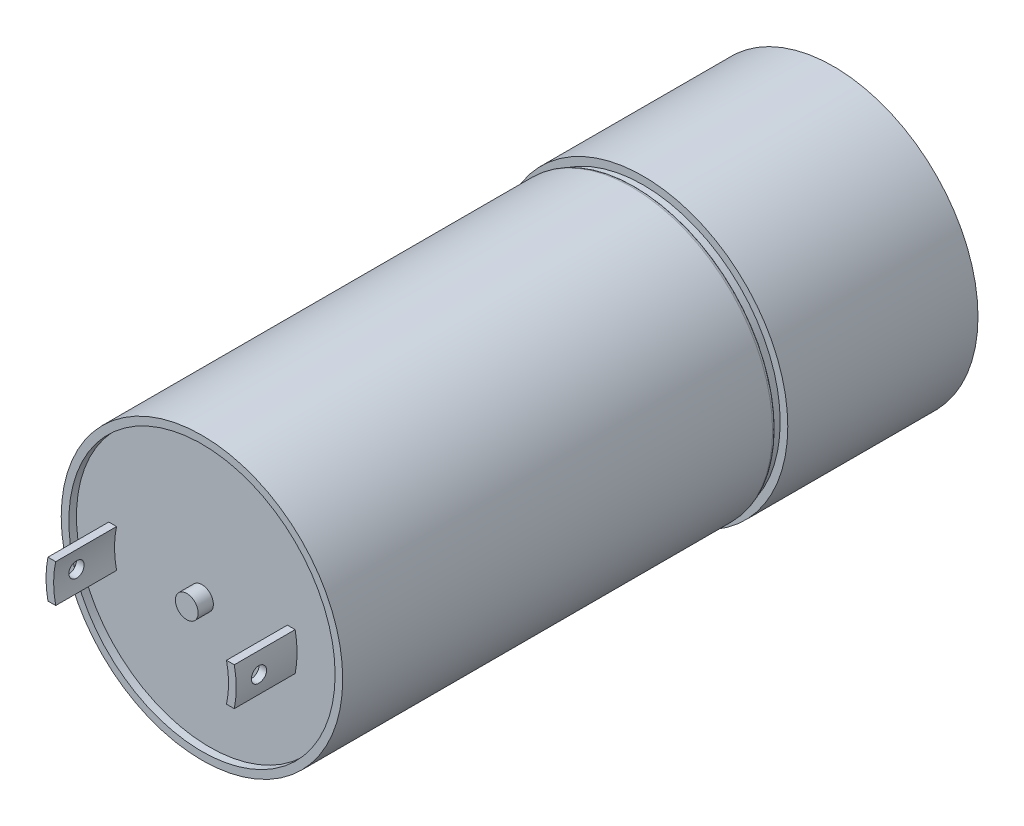
from build123d import *

# Parameters (mm, degrees)
SKETCH_1_R                      = 18.5
EXTRUDE_1_DEPTH                 = 83
SKETCH_2_R                      = 1.5
EXTRUDE_2_DEPTH                 = 2
EXTRUDE_3_DEPTH                 = 8
CUT_EXTRUDE_2_REACH             = 96.686
SKETCH_6_R                      = 1
CUT_EXTRUDE_2_DIRECTION_2_REACH = 96.686
SKETCH_7_R                      = 1.5
CUT_EXTRUDE_3_DEPTH             = 10
SKETCH_8_R                      = 6
EXTRUDE_4_DEPTH                 = 5
SKETCH_10_R                     = 3
CUT_EXTRUDE_4_DEPTH             = 20
SKETCH_11_R                     = 18.5
SKETCH_11_R_2                   = 18
CUT_EXTRUDE_5_DEPTH             = 1
EXTRUDE_START                   = 25
SKETCH_12_R                     = 19
SKETCH_12_R_2                   = 18.5
EXTRUDE_5_DEPTH                 = 25
FILLET_1_R                      = 0.5
SKETCH_13_R                     = 17.5
CUT_EXTRUDE_6_DEPTH             = 1


with BuildPart() as part:
    # 草图1 → 凸台-拉伸1 (new body)
    with BuildSketch(Plane.XY):
        Circle(SKETCH_1_R)
    extrude(amount=EXTRUDE_1_DEPTH)

    # 草图2 → 凸台-拉伸2 (add)
    with BuildSketch(Plane.XY.offset(83)):
        Circle(SKETCH_2_R)
    extrude(amount=EXTRUDE_2_DEPTH)

    # 草图4 → 凸台-拉伸3 (add)
    with BuildSketch(Plane.XY.offset(83)):
        with BuildLine():
            Line((-12.247448714, 2.5), (-11.22497216, 2.5))
            ThreePointArc((-11.22497216, 2.5), (-11.5, 0), (-11.22497216, -2.5))
            Line((-11.22497216, -2.5), (-12.247448714, -2.5))
            ThreePointArc((-12.247448714, -2.5), (-12.5, 0), (-12.247448714, 2.5))
        make_face()
        with BuildLine():
            Line((11.22497216, 2.5), (12.247448714, 2.5))
            ThreePointArc((12.247448714, 2.5), (12.5, 0), (12.247448714, -2.5))
            Line((12.247448714, -2.5), (11.22497216, -2.5))
            ThreePointArc((11.22497216, -2.5), (11.5, 0), (11.22497216, 2.5))
        make_face()
    extrude(amount=EXTRUDE_3_DEPTH)

    # 草图6 → 切除-拉伸2 (cut, up to next)
    with BuildSketch(Plane(origin=(0, 0, 0), x_dir=(0, 0, -1), z_dir=(1, 0, 0)), mode=Mode.PRIVATE) as cut_extrude_2_sk1:
        with Locations(Location((-88, 0, 0), (0, 0, 180))):
            Circle(SKETCH_6_R)
    cut_extrude_2_tool1 = extrude(cut_extrude_2_sk1.sketch, amount=-CUT_EXTRUDE_2_REACH, mode=Mode.PRIVATE) & part.part
    add(cut_extrude_2_tool1.solids().sort_by_distance((0, 0, 88))[0], mode=Mode.SUBTRACT)

    # 草图6 → 切除-拉伸2 direction 2 (cut, up to next)
    with BuildSketch(Plane(origin=(0, 0, 0), x_dir=(0, 0, -1), z_dir=(1, 0, 0)), mode=Mode.PRIVATE) as cut_extrude_2_direction_2_sk1:
        with Locations(Location((-88, 0, 0), (0, 0, 180))):
            Circle(SKETCH_6_R)
    cut_extrude_2_direction_2_tool1 = extrude(cut_extrude_2_direction_2_sk1.sketch, amount=CUT_EXTRUDE_2_DIRECTION_2_REACH, mode=Mode.PRIVATE) & part.part
    add(cut_extrude_2_direction_2_tool1.solids().sort_by_distance((0, 0, 88))[0], mode=Mode.SUBTRACT)

    # 草图7 → 切除-拉伸3 (cut)
    with BuildSketch(Plane(origin=(0, 0, 0), x_dir=(-1, 0, 0), z_dir=(0, 0, -1))):
        with Locations((15.5, 0)):
            Circle(SKETCH_7_R)
        with Locations((7.75, -13.423393759)):
            Circle(SKETCH_7_R)
        with Locations((-7.75, -13.423393759)):
            Circle(SKETCH_7_R)
        with Locations((-15.5, 0)):
            Circle(SKETCH_7_R)
        with Locations((-7.75, 13.423393759)):
            Circle(SKETCH_7_R)
        with Locations((7.75, 13.423393759)):
            Circle(SKETCH_7_R)
    extrude(amount=-CUT_EXTRUDE_3_DEPTH, mode=Mode.SUBTRACT)

    # 草图8 → 凸台-拉伸4 (add)
    with BuildSketch(Plane(origin=(0, 0, 0), x_dir=(-1, 0, 0), z_dir=(0, 0, -1))):
        with Locations(Location((0, 7, 0), (0, 0, 180))):
            Circle(SKETCH_8_R)
    extrude(amount=EXTRUDE_4_DEPTH)

    # 草图10 → 切除-拉伸4 (cut)
    with BuildSketch(Plane(origin=(0, 0, -5), x_dir=(-1, 0, 0), z_dir=(0, 0, -1))):
        with Locations((0, 7)):
            Circle(SKETCH_10_R)
    extrude(amount=-CUT_EXTRUDE_4_DEPTH, mode=Mode.SUBTRACT)

    # 草图11 → 切除-拉伸5 (cut)
    with BuildSketch(Plane(origin=(0, 0, 25), x_dir=(-1, 0, 0), z_dir=(0, 0, -1))):
        Circle(SKETCH_11_R)
        Circle(SKETCH_11_R_2, mode=Mode.SUBTRACT)
    extrude(amount=-CUT_EXTRUDE_5_DEPTH, mode=Mode.SUBTRACT)

    # 草图12 → 凸台-拉伸5 (add)
    with BuildSketch(Plane(origin=(0, 0, 25), x_dir=(-1, 0, 0), z_dir=(0, 0, -1)).offset(EXTRUDE_START)):
        with Locations(Location((0, 0, 0), (0, 0, 180))):
            Circle(SKETCH_12_R)
        Circle(SKETCH_12_R_2, mode=Mode.SUBTRACT)
    extrude(amount=-EXTRUDE_5_DEPTH)

    # 圆角1
    fillet_1_edges = [part.edges().sort_by_distance(p)[0] for p in [
        (-18.5, 0, 26),
    ]]
    fillet(fillet_1_edges, radius=FILLET_1_R - 0.0001)  # a hair under: the kernel refuses the full size

    # 草图13 → 切除-拉伸6 (cut)
    with BuildSketch(Plane.XY.offset(83)):
        Circle(SKETCH_13_R)
    extrude(amount=-CUT_EXTRUDE_6_DEPTH, mode=Mode.SUBTRACT)


with BuildPart() as cut_extrude_6_piece_1:
    # of the separate pieces the step leaves, piece 1, a body of its own (cut_extrude_6_pieces)
    add(part.part.solids().sort_by_distance((18.0001, 0, 26))[0])


with BuildPart() as cut_extrude_6_piece_2:
    # of the separate pieces the step leaves, piece 2, a body of its own (cut_extrude_6_pieces)
    add(part.part.solids().sort_by_distance((-11.22497216, 2.5, 83))[0])


with BuildPart() as cut_extrude_6_piece_3:
    # of the separate pieces the step leaves, piece 3, a body of its own (cut_extrude_6_pieces)
    add(part.part.solids().sort_by_distance((11.22497216, -2.5, 83))[0])


with BuildPart() as cut_extrude_6_piece_4:
    # of the separate pieces the step leaves, piece 4, a body of its own (cut_extrude_6_pieces)
    add(part.part.solids().sort_by_distance((1.5, 0, 83))[0])


solid = Compound([cut_extrude_6_piece_1.part, cut_extrude_6_piece_2.part, cut_extrude_6_piece_3.part, cut_extrude_6_piece_4.part])
